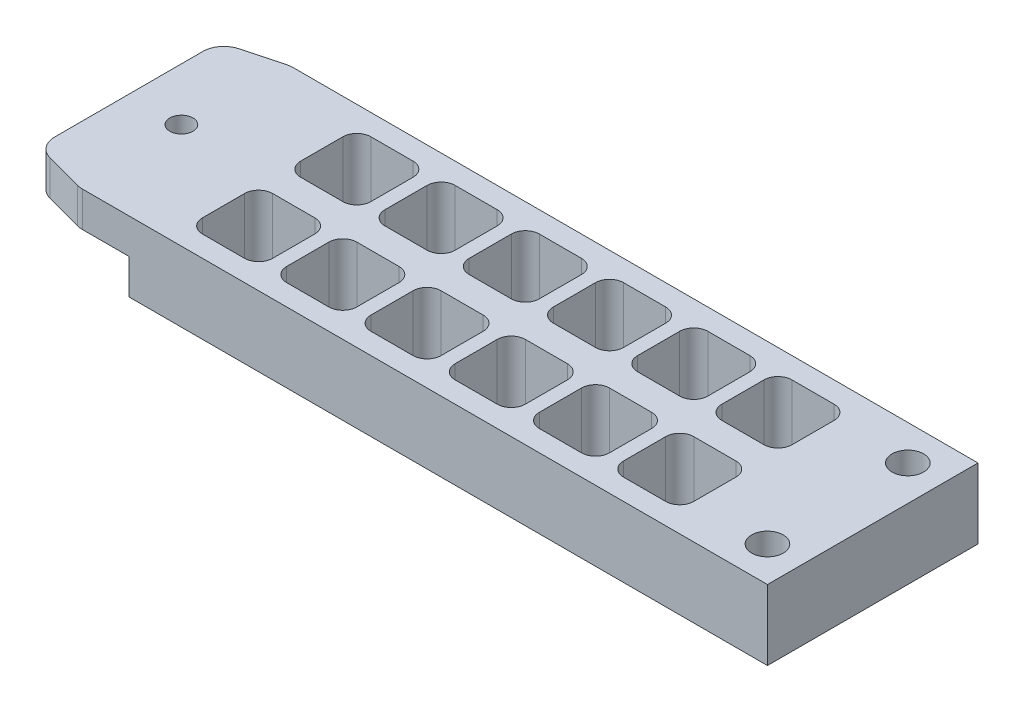
from build123d import *

# Parameters (mm, degrees)
EXTRUDE_1_DEPTH     = 10
SKETCH_4_W          = 15
SKETCH_4_H          = 30
CUT_EXTRUDE_2_DEPTH = 5
FILLET_1_R          = 3
CUT_EXTRUDE_3_DEPTH = 111.616454472
HOLE_WIZARD_M41_D   = 4.5
M4X0_71_D           = 3.3


with BuildPart() as part:
    # Эскиз1 → Бобышка-Вытянуть1 (new body)
    with BuildSketch(Plane(origin=(0, 0, 0), x_dir=(1, 0, 0), z_dir=(0, 1, 0))):
        Polygon((15, 0), (106, 0), (106, 30), (15, 30), (8, 30), (0, 27.856406461), (0, 2.143593539), (8, 0), align=None)
    extrude(amount=EXTRUDE_1_DEPTH)

    # Эскиз4 → Вырез-Вытянуть2 (cut)
    with BuildSketch(Plane.XZ):
        with Locations((7.5, -15)):
            Rectangle(SKETCH_4_W, SKETCH_4_H)
    extrude(amount=-CUT_EXTRUDE_2_DEPTH, mode=Mode.SUBTRACT)

    # Скругление1
    fillet_1_edges = [part.edges().sort_by_distance(p)[0] for p in [
        (8, 7.5, -30),
        (0, 7.5, -27.856406461),
        (0, 7.5, -2.143593539),
        (8, 7.5, 0),
    ]]
    fillet(fillet_1_edges, radius=FILLET_1_R)

    # Эскиз5 → Вырез-Вытянуть3 (cut, through all)
    with BuildSketch(Plane.XZ):
        with BuildLine():
            Line((22.5, -17), (28.5, -17))
            ThreePointArc((28.5, -17), (29.914213562, -17.585786438), (30.5, -19))
            Line((30.5, -19), (30.5, -25))
            ThreePointArc((30.5, -25), (29.914213562, -26.414213562), (28.5, -27))
            Line((28.5, -27), (22.5, -27))
            ThreePointArc((22.5, -27), (21.085786438, -26.414213562), (20.5, -25))
            Line((20.5, -25), (20.5, -19))
            ThreePointArc((20.5, -19), (21.085786438, -17.585786438), (22.5, -17))
        make_face()
        with BuildLine():
            Line((34.5, -17), (40.5, -17))
            ThreePointArc((40.5, -17), (41.914213562, -17.585786438), (42.5, -19))
            Line((42.5, -19), (42.5, -25))
            ThreePointArc((42.5, -25), (41.914213562, -26.414213562), (40.5, -27))
            Line((40.5, -27), (34.5, -27))
            ThreePointArc((34.5, -27), (33.085786438, -26.414213562), (32.5, -25))
            Line((32.5, -25), (32.5, -19))
            ThreePointArc((32.5, -19), (33.085786438, -17.585786438), (34.5, -17))
        make_face()
        with BuildLine():
            Line((46.5, -17), (52.5, -17))
            ThreePointArc((52.5, -17), (53.914213562, -17.585786438), (54.5, -19))
            Line((54.5, -19), (54.5, -25))
            ThreePointArc((54.5, -25), (53.914213562, -26.414213562), (52.5, -27))
            Line((52.5, -27), (46.5, -27))
            ThreePointArc((46.5, -27), (45.085786438, -26.414213562), (44.5, -25))
            Line((44.5, -25), (44.5, -19))
            ThreePointArc((44.5, -19), (45.085786438, -17.585786438), (46.5, -17))
        make_face()
        with BuildLine():
            Line((58.5, -17), (64.5, -17))
            ThreePointArc((64.5, -17), (65.914213562, -17.585786438), (66.5, -19))
            Line((66.5, -19), (66.5, -25))
            ThreePointArc((66.5, -25), (65.914213562, -26.414213562), (64.5, -27))
            Line((64.5, -27), (58.5, -27))
            ThreePointArc((58.5, -27), (57.085786438, -26.414213562), (56.5, -25))
            Line((56.5, -25), (56.5, -19))
            ThreePointArc((56.5, -19), (57.085786438, -17.585786438), (58.5, -17))
        make_face()
        with BuildLine():
            Line((70.5, -17), (76.5, -17))
            ThreePointArc((76.5, -17), (77.914213562, -17.585786438), (78.5, -19))
            Line((78.5, -19), (78.5, -25))
            ThreePointArc((78.5, -25), (77.914213562, -26.414213562), (76.5, -27))
            Line((76.5, -27), (70.5, -27))
            ThreePointArc((70.5, -27), (69.085786438, -26.414213562), (68.5, -25))
            Line((68.5, -25), (68.5, -19))
            ThreePointArc((68.5, -19), (69.085786438, -17.585786438), (70.5, -17))
        make_face()
        with BuildLine():
            Line((82.5, -17), (88.5, -17))
            ThreePointArc((88.5, -17), (89.914213562, -17.585786438), (90.5, -19))
            Line((90.5, -19), (90.5, -25))
            ThreePointArc((90.5, -25), (89.914213562, -26.414213562), (88.5, -27))
            Line((88.5, -27), (82.5, -27))
            ThreePointArc((82.5, -27), (81.085786438, -26.414213562), (80.5, -25))
            Line((80.5, -25), (80.5, -19))
            ThreePointArc((80.5, -19), (81.085786438, -17.585786438), (82.5, -17))
        make_face()
        with BuildLine():
            Line((90.5, -11), (90.5, -5))
            ThreePointArc((90.5, -5), (89.914213562, -3.585786438), (88.5, -3))
            Line((88.5, -3), (82.5, -3))
            ThreePointArc((82.5, -3), (81.085786438, -3.585786438), (80.5, -5))
            Line((80.5, -5), (80.5, -11))
            ThreePointArc((80.5, -11), (81.085786438, -12.414213562), (82.5, -13))
            Line((82.5, -13), (88.5, -13))
            ThreePointArc((88.5, -13), (89.914213562, -12.414213562), (90.5, -11))
        make_face()
        with BuildLine():
            Line((78.5, -11), (78.5, -5))
            ThreePointArc((78.5, -5), (77.914213562, -3.585786438), (76.5, -3))
            Line((76.5, -3), (70.5, -3))
            ThreePointArc((70.5, -3), (69.085786438, -3.585786438), (68.5, -5))
            Line((68.5, -5), (68.5, -11))
            ThreePointArc((68.5, -11), (69.085786438, -12.414213562), (70.5, -13))
            Line((70.5, -13), (76.5, -13))
            ThreePointArc((76.5, -13), (77.914213562, -12.414213562), (78.5, -11))
        make_face()
        with BuildLine():
            Line((66.5, -11), (66.5, -5))
            ThreePointArc((66.5, -5), (65.914213562, -3.585786438), (64.5, -3))
            Line((64.5, -3), (58.5, -3))
            ThreePointArc((58.5, -3), (57.085786438, -3.585786438), (56.5, -5))
            Line((56.5, -5), (56.5, -11))
            ThreePointArc((56.5, -11), (57.085786438, -12.414213562), (58.5, -13))
            Line((58.5, -13), (64.5, -13))
            ThreePointArc((64.5, -13), (65.914213562, -12.414213562), (66.5, -11))
        make_face()
        with BuildLine():
            Line((54.5, -11), (54.5, -5))
            ThreePointArc((54.5, -5), (53.914213562, -3.585786438), (52.5, -3))
            Line((52.5, -3), (46.5, -3))
            ThreePointArc((46.5, -3), (45.085786438, -3.585786438), (44.5, -5))
            Line((44.5, -5), (44.5, -11))
            ThreePointArc((44.5, -11), (45.085786438, -12.414213562), (46.5, -13))
            Line((46.5, -13), (52.5, -13))
            ThreePointArc((52.5, -13), (53.914213562, -12.414213562), (54.5, -11))
        make_face()
        with BuildLine():
            Line((42.5, -11), (42.5, -5))
            ThreePointArc((42.5, -5), (41.914213562, -3.585786438), (40.5, -3))
            Line((40.5, -3), (34.5, -3))
            ThreePointArc((34.5, -3), (33.085786438, -3.585786438), (32.5, -5))
            Line((32.5, -5), (32.5, -11))
            ThreePointArc((32.5, -11), (33.085786438, -12.414213562), (34.5, -13))
            Line((34.5, -13), (40.5, -13))
            ThreePointArc((40.5, -13), (41.914213562, -12.414213562), (42.5, -11))
        make_face()
        with BuildLine():
            Line((30.5, -11), (30.5, -5))
            ThreePointArc((30.5, -5), (29.914213562, -3.585786438), (28.5, -3))
            Line((28.5, -3), (22.5, -3))
            ThreePointArc((22.5, -3), (21.085786438, -3.585786438), (20.5, -5))
            Line((20.5, -5), (20.5, -11))
            ThreePointArc((20.5, -11), (21.085786438, -12.414213562), (22.5, -13))
            Line((22.5, -13), (28.5, -13))
            ThreePointArc((28.5, -13), (29.914213562, -12.414213562), (30.5, -11))
        make_face()
    extrude(amount=-CUT_EXTRUDE_3_DEPTH, mode=Mode.SUBTRACT)

    # Отверстие с зазором M41 (through all)
    with Locations(Plane(origin=(0, 10, 0), x_dir=(1, 0, 0), z_dir=(0, 1, 0))):
        with Locations((101, 25), (101, 5)):
            Hole(HOLE_WIZARD_M41_D / 2)

    # Отверстие обработанное метчиком M4x0.71 (through all)
    with Locations(Plane(origin=(0, 5, 0), x_dir=(-1, 0, 0), z_dir=(0, -1, 0))):
        with Locations((-7.5, 15)):
            Hole(M4X0_71_D / 2)


solid = part.part
